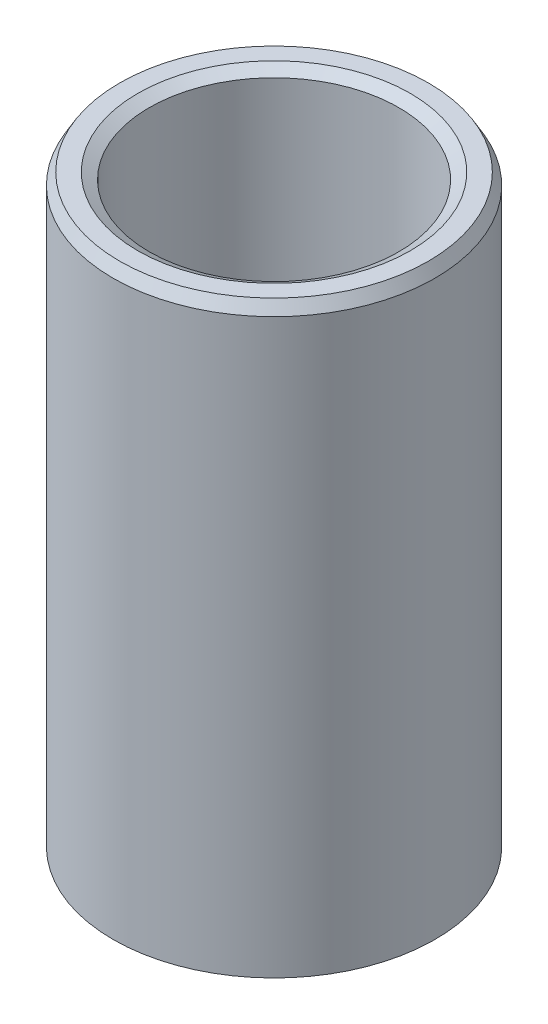
from build123d import *
from OCP.BRepFilletAPI import BRepFilletAPI_MakeChamfer

# Parameters (mm, degrees)
SKETCH1_R           = 40
BOSS_EXTRUDE1_DEPTH = 146.779519059
SKETCH2_R           = 31.020801125
CUT_EXTRUDE1_DEPTH  = 158.302979041
CHAMFER1_SIZE       = 2.845232466
CHAMFER1_SIZE2      = 1.64269573


with BuildPart() as part:
    # Sketch1 → Boss-Extrude1 (new body)
    with BuildSketch(Plane(origin=(0, 0, 0), x_dir=(1, 0, 0), z_dir=(0, 1, 0))):
        Circle(SKETCH1_R)
    extrude(amount=BOSS_EXTRUDE1_DEPTH)

    # Sketch2 → Cut-Extrude1 (cut, through all)
    with BuildSketch(Plane(origin=(0, 0, 0), x_dir=(1, 0, 0), z_dir=(0, 1, 0))):
        Circle(SKETCH2_R)
    extrude(amount=CUT_EXTRUDE1_DEPTH, mode=Mode.SUBTRACT)

    # Chamfer1: one chamfer whose edges measure the first distance from different faces: ONE call of the kernel's chamfer builder (chamfer() names one face for all edges)
    chamfer1_edges_1 = [part.edges().sort_by_distance(p)[0] for p in [
        (-31.020801125, 146.779519059, 0),
    ]]
    chamfer1_side_1 = [part.faces().sort_by_distance(p)[0] for p in [
        (-38.86862915, 146.779519059, 0),
    ]]
    chamfer1_edges_2 = [part.edges().sort_by_distance(p)[0] for p in [
        (-31.020801125, 0, 0),
    ]]
    chamfer1_side_2 = [part.faces().sort_by_distance(p)[0] for p in [
        (-31.020801125, 73.389759529, 0),
    ]]
    chamfer1_edges_3 = [part.edges().sort_by_distance(p)[0] for p in [
        (-40, 0, 0),
    ]]
    chamfer1_side_3 = [part.faces().sort_by_distance(p)[0] for p in [
        (-38.86862915, 0, 0),
    ]]
    chamfer1_edges_4 = [part.edges().sort_by_distance(p)[0] for p in [
        (-40, 146.779519059, 0),
    ]]
    chamfer1_side_4 = [part.faces().sort_by_distance(p)[0] for p in [
        (-40, 73.389759529, 0),
    ]]
    chamfer1 = BRepFilletAPI_MakeChamfer(part.part.solid().wrapped)
    for e in chamfer1_edges_1:
        chamfer1.Add(CHAMFER1_SIZE, CHAMFER1_SIZE2, e.wrapped, chamfer1_side_1[0].wrapped)  # the first distance lies on this face
    for e in chamfer1_edges_2:
        chamfer1.Add(CHAMFER1_SIZE, CHAMFER1_SIZE2, e.wrapped, chamfer1_side_2[0].wrapped)  # the first distance lies on this face
    for e in chamfer1_edges_3:
        chamfer1.Add(CHAMFER1_SIZE, CHAMFER1_SIZE2, e.wrapped, chamfer1_side_3[0].wrapped)  # the first distance lies on this face
    for e in chamfer1_edges_4:
        chamfer1.Add(CHAMFER1_SIZE, CHAMFER1_SIZE2, e.wrapped, chamfer1_side_4[0].wrapped)  # the first distance lies on this face
    add(Compound.cast(chamfer1.Shape()), mode=Mode.REPLACE)


solid = part.part
